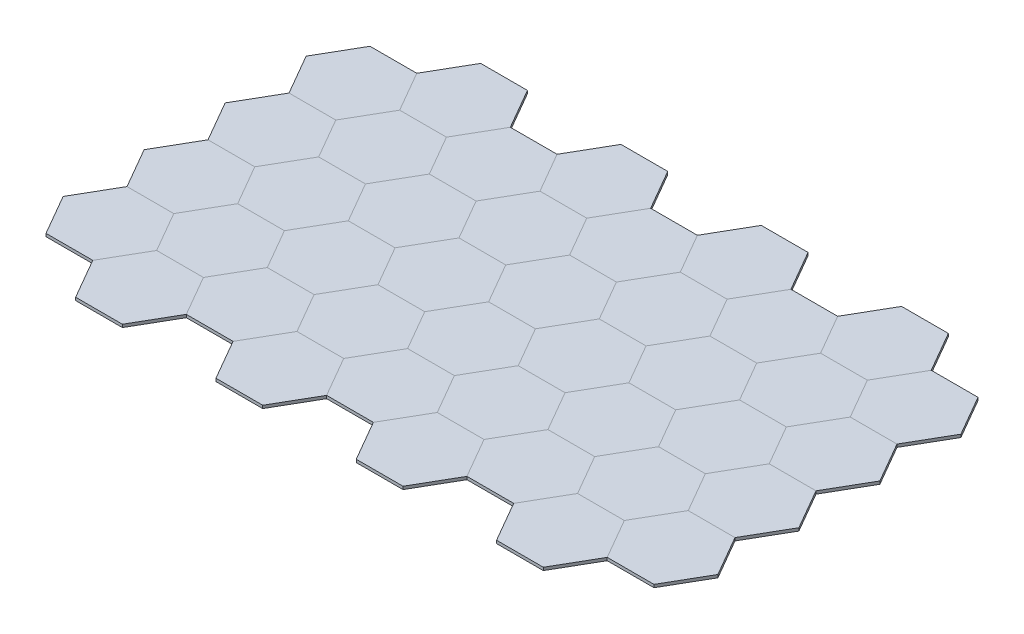
from build123d import *

# Parameters (mm, degrees)
BOSS_EXTRUDE1_DEPTH = 3.175
CIRPATTERN1_COUNT   = 6
LPATTERN1_COUNT     = 4
LPATTERN1_PITCH     = 152.4
LPATTERN2_ANGLE     = 180
LPATTERN2_3_ANGLE   = 120
LPATTERN2_4_ANGLE   = 60
LPATTERN2_6_ANGLE   = 120
LPATTERN2_8_ANGLE   = 120
LPATTERN2_9_ANGLE   = 60
LPATTERN2_10_ANGLE  = 120
LPATTERN2_12_ANGLE  = 60
LPATTERN2_15_ANGLE  = 120
LPATTERN2_16_ANGLE  = 60


with BuildPart() as part:
    # Sketch1 → Boss-Extrude1 (new body)
    with BuildSketch(Plane(origin=(0, 0, 0), x_dir=(1, 0, 0), z_dir=(0, 1, 0))):
        Polygon((50.8, 0), (25.4, 43.994090512), (-25.4, 43.994090512), (-50.8, 0), (-25.4, -43.994090512), (25.4, -43.994090512), align=None)
    extrude(amount=BOSS_EXTRUDE1_DEPTH)


with BuildPart() as body_2:
    # Mirror1: mirrored copy
    add(part.part.mirror(Plane(origin=(25.4, 3.175, 43.994090512), x_dir=(-0.4999999999999999, 0, 0.8660254037844387), z_dir=(-0.8660254037844387, 0, -0.4999999999999999))))


with BuildPart() as cirpattern1_1:
    # CirPattern1: pattern copy
    add(body_2.part.rotate(Axis((0, 0, 0), (0, 1, 0)), 1 * 360 / CIRPATTERN1_COUNT))


with BuildPart() as cirpattern1_2:
    # CirPattern1: pattern copy
    add(body_2.part.rotate(Axis((0, 0, 0), (0, 1, 0)), 2 * 360 / CIRPATTERN1_COUNT))


with BuildPart() as cirpattern1_3:
    # CirPattern1: pattern copy
    add(body_2.part.rotate(Axis((0, 0, 0), (0, 1, 0)), 3 * 360 / CIRPATTERN1_COUNT))


with BuildPart() as cirpattern1_4:
    # CirPattern1: pattern copy
    add(body_2.part.rotate(Axis((0, 0, 0), (0, 1, 0)), 4 * 360 / CIRPATTERN1_COUNT))


with BuildPart() as cirpattern1_5:
    # CirPattern1: pattern copy
    add(body_2.part.rotate(Axis((0, 0, 0), (0, 1, 0)), 5 * 360 / CIRPATTERN1_COUNT))


with BuildPart() as lpattern1_1:
    # LPattern1: pattern copy
    add(cirpattern1_2.part.moved(Location(Vector(1, 0, 0) * (1 * LPATTERN1_PITCH))))


with BuildPart() as lpattern1_2:
    # LPattern1: pattern copy
    add(cirpattern1_2.part.moved(Location(Vector(1, 0, 0) * (2 * LPATTERN1_PITCH))))


with BuildPart() as lpattern1_3:
    # LPattern1: pattern copy
    add(cirpattern1_2.part.moved(Location(Vector(1, 0, 0) * (3 * LPATTERN1_PITCH))))


with BuildPart() as lpattern1_4:
    # LPattern1: pattern copy
    add(part.part.moved(Location(Vector(1, 0, 0) * (1 * LPATTERN1_PITCH))))


with BuildPart() as lpattern1_5:
    # LPattern1: pattern copy
    add(part.part.moved(Location(Vector(1, 0, 0) * (2 * LPATTERN1_PITCH))))


with BuildPart() as lpattern1_6:
    # LPattern1: pattern copy
    add(part.part.moved(Location(Vector(1, 0, 0) * (3 * LPATTERN1_PITCH))))


with BuildPart() as lpattern1_7:
    # LPattern1: pattern copy
    add(cirpattern1_5.part.moved(Location(Vector(1, 0, 0) * (1 * LPATTERN1_PITCH))))


with BuildPart() as lpattern1_8:
    # LPattern1: pattern copy
    add(cirpattern1_5.part.moved(Location(Vector(1, 0, 0) * (2 * LPATTERN1_PITCH))))


with BuildPart() as lpattern1_9:
    # LPattern1: pattern copy
    add(cirpattern1_5.part.moved(Location(Vector(1, 0, 0) * (3 * LPATTERN1_PITCH))))


with BuildPart() as lpattern1_10:
    # LPattern1: pattern copy
    add(body_2.part.moved(Location(Vector(1, 0, 0) * (1 * LPATTERN1_PITCH))))


with BuildPart() as lpattern1_11:
    # LPattern1: pattern copy
    add(body_2.part.moved(Location(Vector(1, 0, 0) * (2 * LPATTERN1_PITCH))))


with BuildPart() as lpattern1_12:
    # LPattern1: pattern copy
    add(body_2.part.moved(Location(Vector(1, 0, 0) * (3 * LPATTERN1_PITCH))))


with BuildPart() as lpattern1_13:
    # LPattern1: pattern copy
    add(cirpattern1_1.part.moved(Location(Vector(1, 0, 0) * (1 * LPATTERN1_PITCH))))


with BuildPart() as lpattern1_14:
    # LPattern1: pattern copy
    add(cirpattern1_1.part.moved(Location(Vector(1, 0, 0) * (2 * LPATTERN1_PITCH))))


with BuildPart() as lpattern1_15:
    # LPattern1: pattern copy
    add(cirpattern1_1.part.moved(Location(Vector(1, 0, 0) * (3 * LPATTERN1_PITCH))))


with BuildPart() as body_23:
    # LPattern2: read off the stored shape, not the designer's step
    # LPattern2: copy of LPattern1_15
    add(lpattern1_15.part.moved(Location((-457.2, 0, -175.9763623))).rotate(Axis((0, 0, 0), (0, 1, 0)), LPATTERN2_ANGLE))


with BuildPart() as body_24:
    # LPattern2 2: copy of LPattern1_6
    add(lpattern1_6.part.moved(Location((-457.2, 0, 175.9763623))))


with BuildPart() as body_25:
    # LPattern2 3: copy of LPattern1_15
    add(lpattern1_15.part.moved(Location((-304.7999998, 0, -87.9881811))).rotate(Axis((0, 0, 0), (0, -1, 0)), LPATTERN2_3_ANGLE))


with BuildPart() as body_26:
    # LPattern2 4: copy of LPattern1_15
    add(lpattern1_15.part.moved(Location((-304.7999998, 0, 87.9881811))).rotate(Axis((0, 0, 0), (0, -1, 0)), LPATTERN2_4_ANGLE))


with BuildPart() as body_27:
    # LPattern2 5: copy of LPattern1_6
    add(lpattern1_6.part.moved(Location((-304.8, 0, 175.9763623))))


with BuildPart() as body_28:
    # LPattern2 6: copy of LPattern1_15
    add(lpattern1_15.part.moved(Location((-380.9999998, 0, -219.9704527))).rotate(Axis((0, 0, 0), (0, -1, 0)), LPATTERN2_6_ANGLE))


with BuildPart() as body_29:
    # LPattern2 7: copy of LPattern1_6
    add(lpattern1_6.part.moved(Location((-152.4, 0, 175.9763623))))


with BuildPart() as body_30:
    # LPattern2 8: copy of LPattern1_15
    add(lpattern1_15.part.moved(Location((-457.1999998, 0, -351.9527242))).rotate(Axis((0, 0, 0), (0, -1, 0)), LPATTERN2_8_ANGLE))


with BuildPart() as body_31:
    # LPattern2 9: copy of LPattern1_15
    add(lpattern1_15.part.moved(Location((-152.3999998, 0, -175.9763619))).rotate(Axis((0, 0, 0), (0, -1, 0)), LPATTERN2_9_ANGLE))


with BuildPart() as body_32:
    # LPattern2 10: copy of LPattern1_15
    add(lpattern1_15.part.moved(Location((-609.6000002, 0, -87.9881811))).rotate(Axis((0, 0, 0), (0, 1, 0)), LPATTERN2_10_ANGLE))


with BuildPart() as body_33:
    # LPattern2 11: copy of LPattern1_15
    add(lpattern1_15.part.moved(Location((-304.8, 0, 175.9763623))))


with BuildPart() as body_34:
    # LPattern2 12: copy of LPattern1_15
    add(lpattern1_15.part.moved(Location((-228.5999998, 0, -43.9940904))).rotate(Axis((0, 0, 0), (0, -1, 0)), LPATTERN2_12_ANGLE))


with BuildPart() as body_35:
    # LPattern2 13: copy of LPattern1_15
    add(lpattern1_15.part.moved(Location((-152.4, 0, 175.9763623))))


with BuildPart() as body_36:
    # LPattern2 14: mirrored copy
    add(lpattern1_10.part.mirror(Plane(origin=(304.800000053, 0, 175.97636208), x_dir=(0.5000000000001897, 0, -0.866025403784329), z_dir=(0.866025403784329, 0, 0.50000000000019))))


with BuildPart() as body_37:
    # LPattern2 15: copy of LPattern1_15
    add(lpattern1_15.part.moved(Location((-533.3999998, 0, -483.9349958))).rotate(Axis((0, 0, 0), (0, -1, 0)), LPATTERN2_15_ANGLE))


with BuildPart() as body_38:
    # LPattern2 16: copy of LPattern1_15
    add(lpattern1_15.part.moved(Location((-76.1999998, 0, -307.9586335))).rotate(Axis((0, 0, 0), (0, -1, 0)), LPATTERN2_16_ANGLE))


with BuildPart() as body_39:
    # LPattern2 17: copy of LPattern1_15
    add(lpattern1_15.part.moved(Location((0, 0, 175.9763623))))


with BuildPart() as body_40:
    # LPattern2 18: copy of LPattern1_15
    add(lpattern1_15.part.moved(Location((-457.2, 0, 175.9763623))))


solid = Compound([part.part, body_2.part, cirpattern1_1.part, cirpattern1_2.part, cirpattern1_3.part, cirpattern1_4.part, cirpattern1_5.part, lpattern1_1.part, lpattern1_2.part, lpattern1_3.part, lpattern1_4.part, lpattern1_5.part, lpattern1_6.part, lpattern1_7.part, lpattern1_8.part, lpattern1_9.part, lpattern1_10.part, lpattern1_11.part, lpattern1_12.part, lpattern1_13.part, lpattern1_14.part, lpattern1_15.part, body_23.part, body_24.part, body_25.part, body_26.part, body_27.part, body_28.part, body_29.part, body_30.part, body_31.part, body_32.part, body_33.part, body_34.part, body_35.part, body_36.part, body_37.part, body_38.part, body_39.part, body_40.part])
